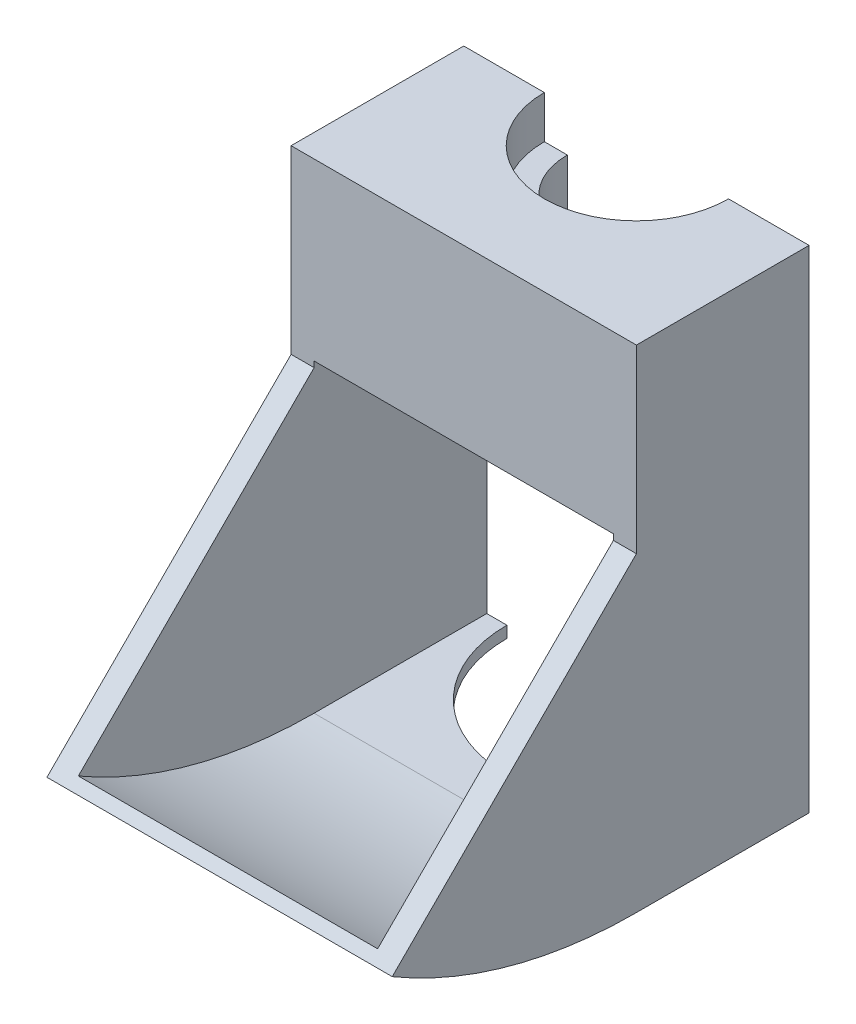
from build123d import *

# Parameters (mm, degrees)
SKETCH2_W           = 30
SKETCH2_H           = 42.7
BOSS_EXTRUDE1_DEPTH = 15
BOSS_EXTRUDE2_DEPTH = 15
CUT_EXTRUDE1_DEPTH  = 13


with BuildPart() as part:
    # Sketch2 → Boss-Extrude1 (new body)
    with BuildSketch(Plane.XY):
        with Locations((0, 21.35)):
            Rectangle(SKETCH2_W, SKETCH2_H)
    extrude(amount=BOSS_EXTRUDE1_DEPTH)

    # Sketch3 → Boss-Extrude2 (add, symmetric)
    with BuildSketch(Plane(origin=(0, 0, 0), x_dir=(0, 0, -1), z_dir=(1, 0, 0))):
        with BuildLine():
            ThreePointArc((-36.213203436, 5.786796564), (-25.994169074, 1.472656241), (-15, 0))
            Line((-15, 0), (-15, 27))
            Line((-15, 27), (-36.213203436, 5.786796564))
        make_face()
    extrude(amount=BOSS_EXTRUDE2_DEPTH, both=True)

    # Sketch4 → Cut-Revolve1 (revolve, cut)
    with BuildSketch(Plane(origin=(0, 0, 0), x_dir=(-1, 0, 0), z_dir=(0, 0, -1))):
        Polygon((0, 42.7), (8, 42.7), (8, 39), (6, 39), (6, 33), (8, 33), (8, 27.5), (11.25, 27.5), (11.25, 0), (0, 0), align=None)
    revolve(axis=Axis((0, 51.479366375, 0), (0, -1, 0)), mode=Mode.SUBTRACT)

    # Sketch5 → Cut-Extrude1 (cut, symmetric)
    with BuildSketch(Plane(origin=(0, 0, 0), x_dir=(0, 0, -1), z_dir=(1, 0, 0))):
        with BuildLine():
            Line((-35.482290693, 6.517709307), (-15.707106781, 26.292893219))
            Line((-15.707106781, 26.292893219), (-16.914213562, 27.5))
            Line((-16.914213562, 27.5), (-11.25, 27.5))
            Line((-11.25, 27.5), (0, 27.5))
            Line((0, 27.5), (0, 1))
            Line((0, 1), (-15, 1))
            ThreePointArc((-15, 1), (-25.606240475, 2.403584898), (-35.482290693, 6.517709307))
        make_face()
    extrude(amount=CUT_EXTRUDE1_DEPTH, both=True, mode=Mode.SUBTRACT)


solid = part.part
